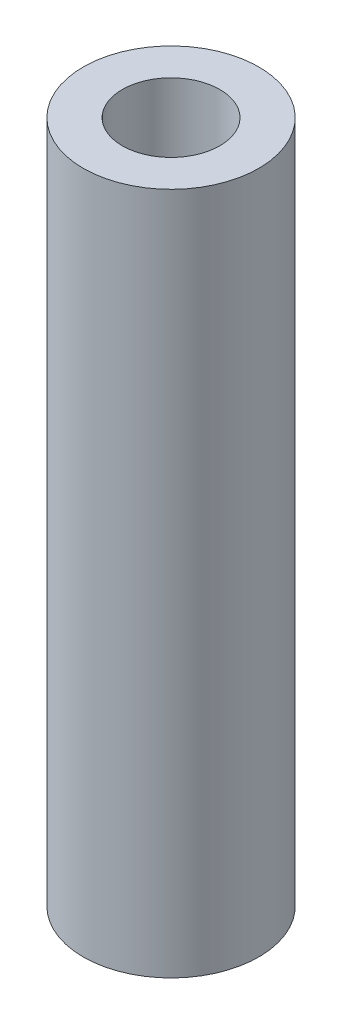
from build123d import *

# Parameters (mm, degrees)
SZKIC1_W = 28
SZKIC1_H = 490


with BuildPart() as part:
    # Szkic1 → Obrót1 (revolve)
    with BuildSketch(Plane.XY):
        with Locations((49, 0)):
            Rectangle(SZKIC1_W, SZKIC1_H)
    revolve(axis=Axis((0, 344.744344029, 0), (0, -1, 0)))


solid = part.part
